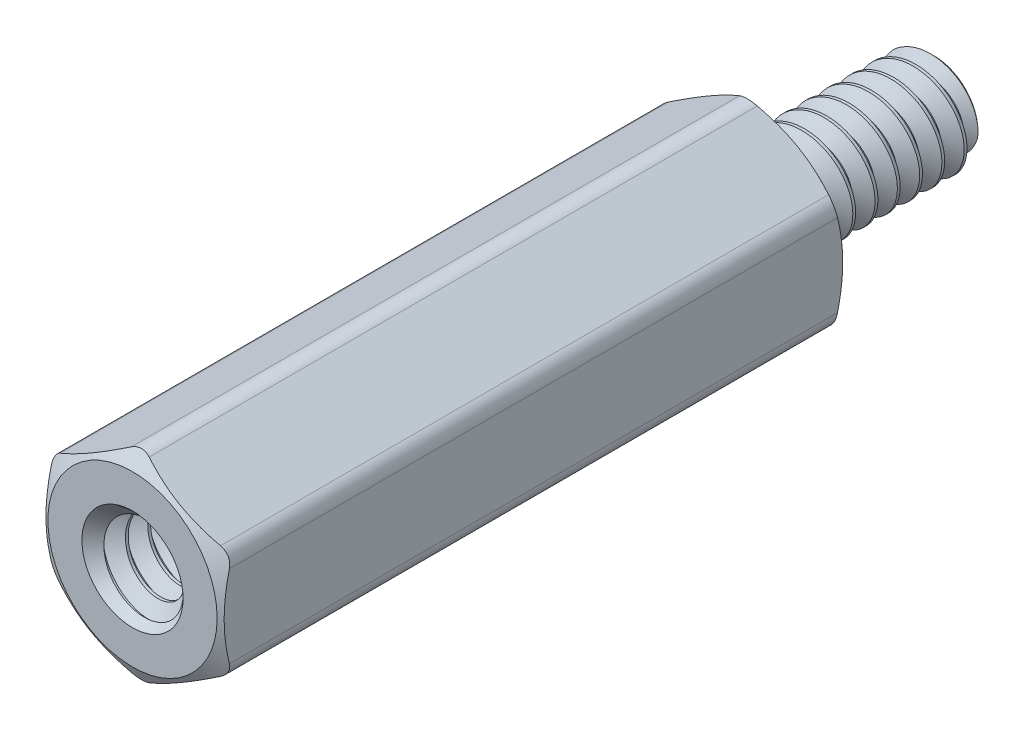
from build123d import *

# Parameters (mm, degrees)
SKETCH4_R              = 2.4638
BOSS_EXTRUDE1_DEPTH    = 22.225
SKETCH5_OUTSIDE_W      = 118.252
SKETCH5_OUTSIDE_H      = 119.234
SKETCH5_OUTSIDE_R      = 3.01625
CUT_EXTRUDE1_DEPTH     = 29.983652001
CUT_EXTRUDE1_DRAFT     = -60
SKETCH6_OUTSIDE_W      = 96.65
SKETCH6_OUTSIDE_H      = 97.632
SKETCH6_OUTSIDE_R      = 3.01625
CUT_EXTRUDE2_DEPTH     = 23.748012734
CUT_EXTRUDE2_DRAFT     = -60
FILLET1_R              = 0.635
CUT_SWEEP1_PITCH       = 0.79375
CUT_SWEEP1_HEIGHT      = 6.1595
CUT_SWEEP1_RADIUS      = 1.7526
CUT_SWEEP1_START_ANGLE = 90
SKETCH9_R              = 1.9510375
BOSS_EXTRUDE2_DEPTH    = 9.525
SKETCH10_W             = 9.525
SKETCH10_H             = 1.7526
CUT_SWEEP2_PITCH       = 0.79375
CUT_SWEEP2_HEIGHT      = 10.31875
CUT_SWEEP2_RADIUS      = 1.7526
CUT_SWEEP2_START_ANGLE = 90


with BuildPart() as part:
    # Sketch3 → Revolve1 (revolve)
    with BuildSketch(Plane(origin=(0, 0, 0), x_dir=(0, 0, -1), z_dir=(1, 0, 0))):
        with BuildLine():
            Line((-12.7, 1.5541625), (-12.7, 0))
            Line((-12.7, 0), (6.35, 0))
            Line((6.35, 0), (6.35, 1.5541625))
            Line((6.35, 1.5541625), (6.1515625, 1.7526))
            Line((6.1515625, 1.7526), (1.05965625, 1.7526))
            Line((1.05965625, 1.7526), (0.762, 1.237044252))
            Line((0.762, 1.237044252), (0.1984375, 1.237044252))
            ThreePointArc((0.1984375, 1.237044252), (0.058120998, 1.29516525), (0, 1.435481752))
            Line((0, 1.435481752), (0, 3.175))
            Line((0, 3.175), (-22.225, 3.175))
            Line((-22.225, 3.175), (-22.225, 1.9510375))
            Line((-22.225, 1.9510375), (-22.0265625, 1.7526))
            Line((-22.0265625, 1.7526), (-12.8984375, 1.7526))
            Line((-12.8984375, 1.7526), (-12.7, 1.5541625))
        make_face()
    revolve(axis=Axis((0, 0, -6.35), (0, 0, 1)))

    # Sketch4 → Boss-Extrude1 (add)
    with BuildSketch(Plane.XY.offset(22.225)):
        Polygon((-3.175, 1.833087105), (-3.175, -1.833087105), (0, -3.666174209), (3.175, -1.833087105), (3.175, 1.833087105), (0, 3.666174209), align=None)
        Circle(SKETCH4_R, mode=Mode.SUBTRACT)
    extrude(amount=-BOSS_EXTRUDE1_DEPTH)


with BuildPart() as cut_extrude1_tool:
    # Sketch5 outside → Cut-Extrude1 (with draft: the straight prism first)
    with BuildSketch(Plane.XY.offset(22.225)):
        Rectangle(SKETCH5_OUTSIDE_W, SKETCH5_OUTSIDE_H)
        Circle(SKETCH5_OUTSIDE_R, mode=Mode.SUBTRACT)
    extrude(amount=-CUT_EXTRUDE1_DEPTH)
    # Cut-Extrude1: the draft: its side faces are tilted about the plane it starts from
    cut_extrude1_sides = [cut_extrude1_tool.faces().sort_by_distance(p)[0] for p in [
        (0, -59.617, 7.233173999),
        (59.126, 0, 7.233173999),
        (0, 59.617, 7.233173999),
        (-59.126, 0, 7.233173999),
        (-3.01625, 0, 7.233173999),
    ]]
    draft(cut_extrude1_sides, Plane.XY.offset(22.225), CUT_EXTRUDE1_DRAFT)


with BuildPart() as part_1:
    add(part.part)

    # Cut-Extrude1: cut by cut_extrude1_tool
    add(cut_extrude1_tool.part, mode=Mode.SUBTRACT)


with BuildPart() as cut_extrude2_tool:
    # Sketch6 outside → Cut-Extrude2 (with draft: the straight prism first)
    with BuildSketch(Plane(origin=(0, 0, 0), x_dir=(-1, 0, 0), z_dir=(0, 0, -1))):
        Rectangle(SKETCH6_OUTSIDE_W, SKETCH6_OUTSIDE_H)
        Circle(SKETCH6_OUTSIDE_R, mode=Mode.SUBTRACT)
    extrude(amount=-CUT_EXTRUDE2_DEPTH)
    # Cut-Extrude2: the draft: its side faces are tilted about the plane it starts from
    cut_extrude2_sides = [cut_extrude2_tool.faces().sort_by_distance(p)[0] for p in [
        (0, -48.816, 11.874006367),
        (-48.325, 0, 11.874006367),
        (0, 48.816, 11.874006367),
        (48.325, 0, 11.874006367),
        (3.01625, 0, 11.874006367),
    ]]
    draft(cut_extrude2_sides, Plane(origin=(0, 0, 0), x_dir=(-1, 0, 0), z_dir=(0, 0, -1)), CUT_EXTRUDE2_DRAFT)


with BuildPart() as part_2:
    add(part_1.part)

    # Cut-Extrude2: cut by cut_extrude2_tool
    add(cut_extrude2_tool.part, mode=Mode.SUBTRACT)

    # Fillet1
    fillet1_edges = [part_2.edges().sort_by_distance(p)[0] for p in [
        (0, 3.666174209, 11.1125),
        (-3.175, -1.833087105, 11.1125),
        (0, -3.666174209, 11.1125),
        (3.175, -1.833087105, 11.1125),
        (3.175, 1.833087105, 11.1125),
        (-3.175, 1.833087105, 11.1125),
    ]]
    fillet(fillet1_edges, radius=FILLET1_R)

    # Cut-Sweep1: sweep along a helix
    with BuildLine() as cut_sweep1_path:
        add(Helix(CUT_SWEEP1_PITCH, CUT_SWEEP1_HEIGHT, CUT_SWEEP1_RADIUS, center=(0, 0, -6.35), direction=(0, 0, 1), mode=Mode.PRIVATE).rotate(Axis((0, 0, -6.35), (0, 0, 1)), CUT_SWEEP1_START_ANGLE))
    # Sketch7 → Cut-Sweep1 (sweep, cut)
    with BuildSketch(Plane.ZY):
        Polygon((-6.64765625, 1.237044252), (-6.746875, 1.237044252), (-7.069335938, 1.795562979), (-6.325195312, 1.795562979), align=None)
    sweep(path=cut_sweep1_path.line, is_frenet=True, mode=Mode.SUBTRACT)

    # Sketch9 → Boss-Extrude2 (add)
    with BuildSketch(Plane.XY.offset(12.7)):
        Circle(SKETCH9_R)
    extrude(amount=BOSS_EXTRUDE2_DEPTH)


with BuildPart() as body_2:
    # Sketch10 → Revolve2 (revolve)
    with BuildSketch(Plane(origin=(0, 0, 0), x_dir=(0, 0, -1), z_dir=(1, 0, 0))):
        with Locations((-17.4625, 0.8763)):
            Rectangle(SKETCH10_W, SKETCH10_H)
    revolve(axis=Axis((0, 0, -6.35), (0, 0, 1)))

    # Cut-Sweep2: sweep along a helix
    with BuildLine() as cut_sweep2_path:
        add(Helix(CUT_SWEEP2_PITCH, CUT_SWEEP2_HEIGHT, CUT_SWEEP2_RADIUS, center=(0, 0, 22.225), direction=(0, 0, -1), mode=Mode.PRIVATE).rotate(Axis((0, 0, 22.225), (0, 0, -1)), CUT_SWEEP2_START_ANGLE))
    # Sketch12 → Cut-Sweep2 (sweep, cut)
    with BuildSketch(Plane(origin=(0, 0, 0), x_dir=(0, 0, -1), z_dir=(1, 0, 0))):
        Polygon((-22.621875, 1.237044252), (-22.52265625, 1.237044252), (-22.200195313, 1.795562979), (-22.944335938, 1.795562979), align=None)
    sweep(path=cut_sweep2_path.line, is_frenet=True, mode=Mode.SUBTRACT)


with BuildPart() as part_3:
    add(part_2.part)

    # Combine1: cut body 2
    add(body_2.part, mode=Mode.SUBTRACT)

    # Cut-Extrude3 cone 1 section (through the dimple's axis) → Cut-Extrude3 (revolve, cut)
    with BuildSketch(Plane(origin=(0, 0, 22.225), x_dir=(0, -1, 0), z_dir=(1, 0, 0))):
        Polygon((0, 0), (1.8034, 0), (0, 1.8034), align=None)
    revolve(axis=Axis((0, 0, 22.225), (0, 0, -1)), mode=Mode.SUBTRACT)


solid = part_3.part
